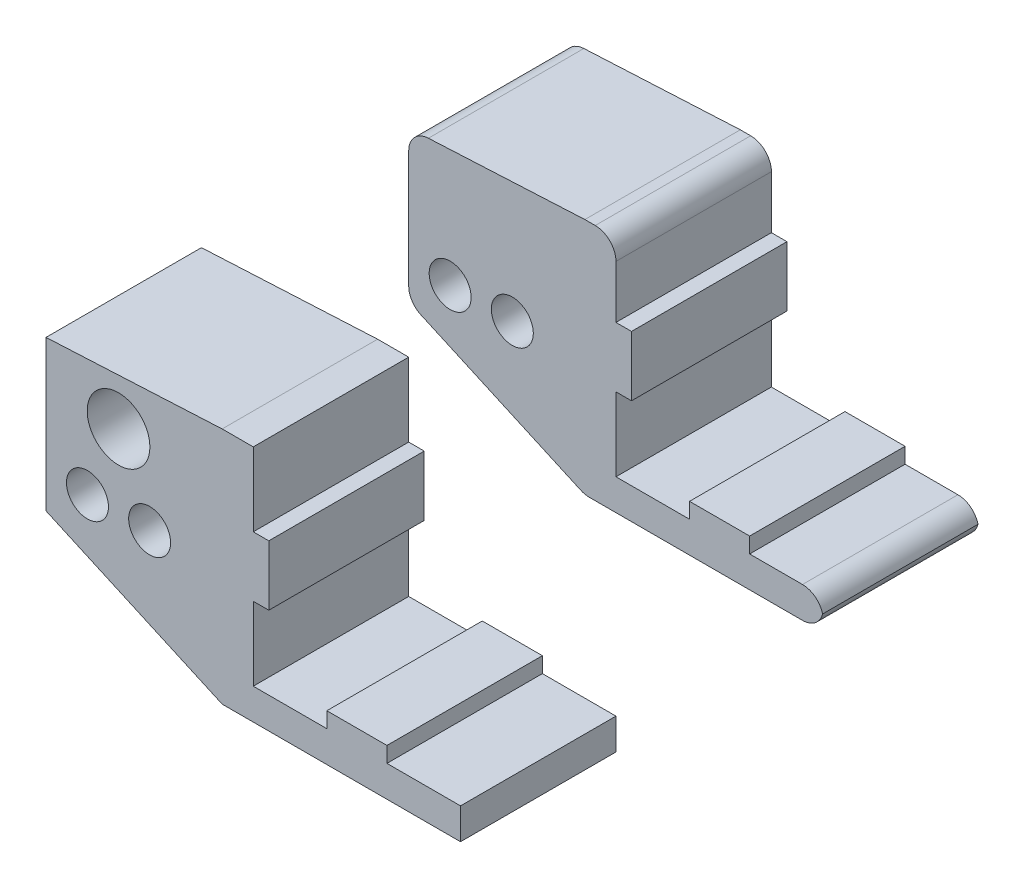
from build123d import *

# Parameters (mm, degrees)
SKETCH1_R           = 3.025
SKETCH1_R_2         = 2.025
BOSS_EXTRUDE1_DEPTH = 15
BOSS_EXTRUDE2_START = 6
SKETCH1_2_R         = 3.025
BOSS_EXTRUDE2_DEPTH = 9
SKETCH2_R           = 2.65
CUT_EXTRUDE1_DEPTH  = 3
FILLET1_R           = 2


with BuildPart() as part:
    # Sketch1 → Boss-Extrude1 (new body)
    with BuildSketch(Plane.XY):
        Polygon((66.489922843, -72.31585339), (69.489922843, -72.31585339), (69.489922843, -79.41585339), (70.989922843, -79.41585339), (70.989922843, -85.21585339), (69.489922843, -85.21585339), (69.489922843, -92.31585339), (76.589922843, -92.31585339), (76.589922843, -90.81585339), (82.389922843, -90.81585339), (82.389922843, -92.31585339), (89.489922843, -92.31585339), (89.489922843, -95.31585339), (66.489922843, -95.31585339), (49.489922843, -87.66585339), (49.489922843, -73.16585339), align=None)
        with Locations((56.489922843, -77.31585339)):
            Circle(SKETCH1_R, mode=Mode.SUBTRACT)
        with Locations((53.489922843, -84.31585339)):
            Circle(SKETCH1_R_2, mode=Mode.SUBTRACT)
        with Locations((59.489922843, -84.31585339)):
            Circle(SKETCH1_R_2, mode=Mode.SUBTRACT)
    extrude(amount=BOSS_EXTRUDE1_DEPTH)

    # Sketch1<2> → Boss-Extrude2 (add)
    with BuildSketch(Plane.XY.offset(BOSS_EXTRUDE2_START)):
        with Locations((56.489922843, -77.31585339)):
            Circle(SKETCH1_2_R)
    extrude(amount=BOSS_EXTRUDE2_DEPTH)

    # Sketch2 → Cut-Extrude1 (cut)
    with BuildSketch(Plane.XZ.offset(95.31585339)):
        with Locations(Location((79.489922843, 7.5, 0), (0, 0, 270))):
            Circle(SKETCH2_R)
    extrude(amount=-CUT_EXTRUDE1_DEPTH, mode=Mode.SUBTRACT)


with BuildPart() as body_2:
    # Mirror4: mirrored copy
    add(part.part.mirror(Plane.XY.offset(25)))


with BuildPart() as part_1:
    add(part.part)

    # Fillet1
    # the kernel refuses this fillet: 2 mm, written as the material it takes off along each edge
    with BuildSketch(Plane(origin=(89.489922843, -95.31585339, -5), x_dir=(0, 1, 0), z_dir=(0, 0, 1)), Plane(origin=(89.489922843, -92.31585339, -5), x_dir=(-1, 0, 0), z_dir=(0, 0, 1)), Plane(origin=(69.489922843, -72.31585339, -5), x_dir=(-1, 0, 0), z_dir=(0, 0, 1))) as fillet1_piece_1:
        with BuildLine():
            CenterArc((FILLET1_R, FILLET1_R), FILLET1_R, 180, 90)
            Line((0, FILLET1_R), (0, 0))
            Line((0, 0), (FILLET1_R, 0))
        make_face()
    extrude(amount=25, mode=Mode.SUBTRACT)
    with BuildSketch(Plane(origin=(66.489922843, -95.31585339, -1.073173444), x_dir=(1, 0, 0), z_dir=(0, 0, 1))) as fillet1_piece_2:
        with BuildLine():
            CenterArc((FILLET1_R * 0.214634688829, FILLET1_R), FILLET1_R, 245.772254682, 24.227745318)
            Line((-FILLET1_R * 0.1957299885, FILLET1_R * 0.0880784948249), (0, 0))
            Line((0, 0), (FILLET1_R * 0.214634688829, 0))
        make_face()
    extrude(amount=17.146346888, mode=Mode.SUBTRACT)
    with BuildSketch(Plane(origin=(49.489922843, -87.66585339, -3.23292805), x_dir=(0, 1, 0), z_dir=(0, 0, 1))) as fillet1_piece_3:
        with BuildLine():
            CenterArc((FILLET1_R * 0.646585609973, -FILLET1_R), FILLET1_R, 90, 65.772254682)
            Line((-FILLET1_R * 0.265335895202, -FILLET1_R * 0.589635322671), (0, 0))
            Line((0, 0), (FILLET1_R * 0.646585609973, 0))
        make_face()
    extrude(amount=21.4658561, mode=Mode.SUBTRACT)
    with BuildSketch(Plane(origin=(49.489922843, -73.16585339, -4.756246099), x_dir=(0.9987523388778446, 0.0499376169438941, 0), z_dir=(0, 0, 1))) as fillet1_piece_4:
        with BuildLine():
            CenterArc((FILLET1_R * 0.951249219725, -FILLET1_R), FILLET1_R, 90, 87.137594774)
            Line((-FILLET1_R * 0.0475031191528, -FILLET1_R * 0.950062383056), (0, 0))
            Line((0, 0), (FILLET1_R * 0.951249219725, 0))
        make_face()
    extrude(amount=24.512492197, mode=Mode.SUBTRACT)


solid = Compound([body_2.part, part_1.part])
